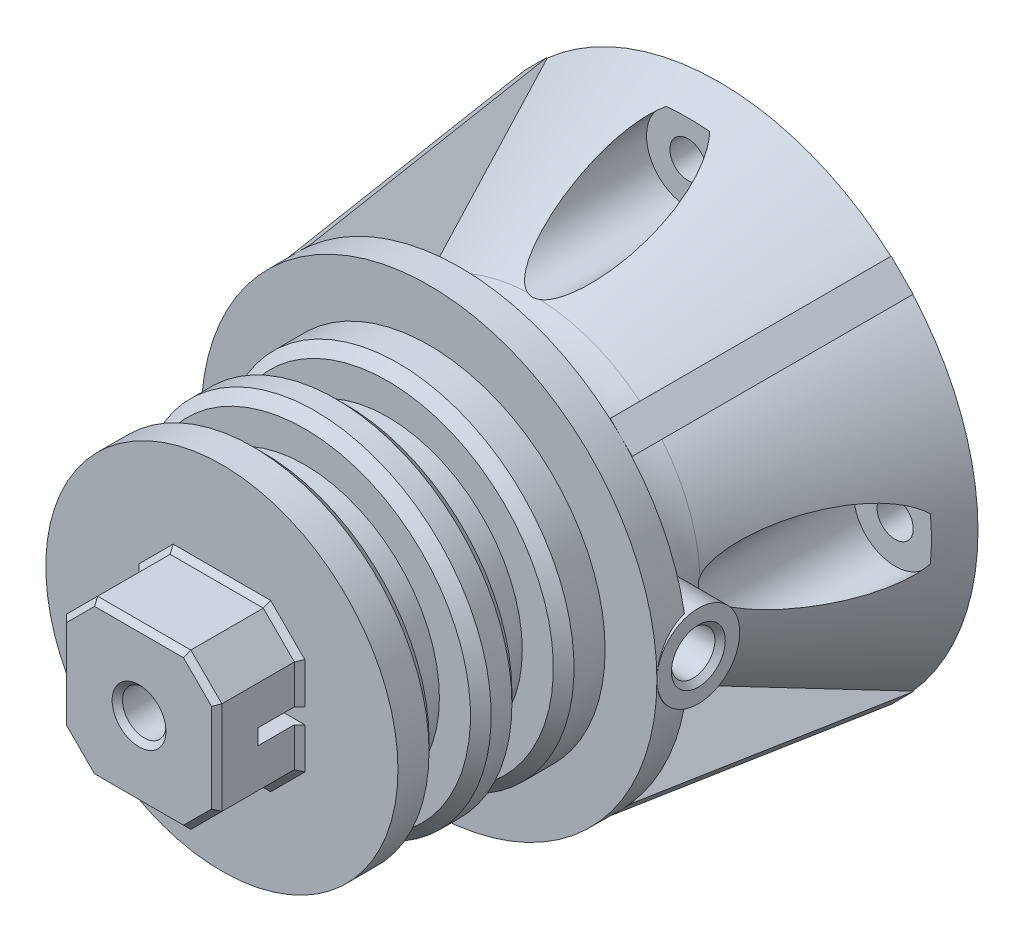
from build123d import *
from build123d.topology import SkipClean

# Parameters (mm, degrees)
SKETCH2_R           = 15
SKETCH1_R           = 25
SKETCH3_R           = 15
BOSS_EXTRUDE1_DEPTH = 5
FILLET1_R           = 10
SKETCH4_R           = 1.75
CUT_EXTRUDE1_DEPTH  = 130
SKETCH5_R           = 4
CUT_EXTRUDE2_DEPTH  = 130
SKETCH6_R           = 22
BOSS_EXTRUDE2_DEPTH = 3
SKETCH7_R           = 17
BOSS_EXTRUDE3_DEPTH = 20
SKETCH14_R          = 4
BOSS_EXTRUDE5_DEPTH = 10
SKETCH9_R           = 2.1
SKETCH10_R          = 10
CUT_EXTRUDE3_DEPTH  = 20
BOSS_EXTRUDE4_DEPTH = 1.5
CIRPATTERN2_COUNT   = 4
SKETCH15_W          = 8.431609766
SKETCH15_H          = 4
SKETCH15_W_2        = 8.578672696
SKETCH16_R          = 6.5
SKETCH16_R_2        = 2.5
BOSS_EXTRUDE6_DEPTH = 10
CHAMFER1_SIZE       = 1
CUT_EXTRUDE4_START  = -2
SKETCH17_R          = 4
CUT_EXTRUDE4_DEPTH  = 2
CHAMFER2_SIZE       = 0.5
SKETCH18_R          = 12.5
CUT_EXTRUDE5_DEPTH  = 20
BOSS_EXTRUDE7_START = 20
SKETCH19_R          = 10
BOSS_EXTRUDE7_DEPTH = 20
SKETCH20_W          = 15
SKETCH20_H          = 8
BOSS_EXTRUDE8_DEPTH = 7.5
CUT_EXTRUDE6_DEPTH  = 0.75
CUT_EXTRUDE7_START  = -28
SKETCH22_R          = 2.1
CUT_EXTRUDE7_DEPTH  = 28
CHAMFER3_SIZE       = 3
CHAMFER4_SIZE       = 0.5


with BuildPart() as part:
    # Sketch2 → Loft1 section 0
    with BuildSketch(Plane.XY.offset(20)):
        Circle(SKETCH2_R)
    # Sketch1 → Loft1 section 1
    with BuildSketch(Plane.XY):
        Circle(SKETCH1_R)
    loft()

    # Sketch3 → Boss-Extrude1 (add)
    with BuildSketch(Plane.XY.offset(20)):
        Circle(SKETCH3_R)
    extrude(amount=BOSS_EXTRUDE1_DEPTH)

    # Fillet1
    fillet1_edges = [part.edges().sort_by_distance(p)[0] for p in [
        (-15, 0, 20),
    ]]
    fillet(fillet1_edges, radius=FILLET1_R)

    # Sketch4 → Cut-Extrude1 (cut)
    with BuildSketch(Plane(origin=(0, 0, 0), x_dir=(-1, 0, 0), z_dir=(0, 0, -1))):
        with Locations((0, 20)):
            Circle(SKETCH4_R)
        with Locations((-20, 0)):
            Circle(SKETCH4_R)
        with Locations((0, -20)):
            Circle(SKETCH4_R)
        with Locations((20, 0)):
            Circle(SKETCH4_R)
    extrude(amount=-CUT_EXTRUDE1_DEPTH, mode=Mode.SUBTRACT)

    # Sketch5 → Cut-Extrude2 (cut)
    with BuildSketch(Plane(origin=(0, 0, 3), x_dir=(-1, 0, 0), z_dir=(0, 0, -1))):
        with Locations((0, 20)):
            Circle(SKETCH5_R)
        with Locations((20, 0)):
            Circle(SKETCH5_R)
        with Locations((-20, 0)):
            Circle(SKETCH5_R)
        with Locations((0, -20)):
            Circle(SKETCH5_R)
    extrude(amount=-CUT_EXTRUDE2_DEPTH, mode=Mode.SUBTRACT)

    # Sketch6 → Boss-Extrude2 (add)
    with BuildSketch(Plane.XY.offset(25)):
        Circle(SKETCH6_R)
    extrude(amount=BOSS_EXTRUDE2_DEPTH)

    # Sketch7 → Boss-Extrude3 (add)
    with BuildSketch(Plane.XY.offset(28)):
        Circle(SKETCH7_R)
    extrude(amount=BOSS_EXTRUDE3_DEPTH)

    # Sketch14 → Boss-Extrude5 (add)
    with BuildSketch(Plane(origin=(14, 0, 0), x_dir=(0, 0, -1), z_dir=(1, 0, 0))):
        with Locations(Location((-24, 0, 0), (0, 0, 180.000000004))):
            Circle(SKETCH14_R)
    extrude(amount=BOSS_EXTRUDE5_DEPTH)

    # Cut-Sweep1: sweep along a path in Sketch8
    with BuildLine(Plane(origin=(0, 0, 0), x_dir=(1, 0, 0), z_dir=(0, 1, 0))) as cut_sweep1_path:
        Line((0, -48), (0, -27))
        ThreePointArc((0, -27), (0.878679656, -24.878679656), (3, -24))
        Line((3, -24), (45.481948524, -24))
    # Sketch9 → Cut-Sweep1 (sweep, cut)
    with BuildSketch(Plane.XY.offset(48)):
        Circle(SKETCH9_R)
    sweep(path=cut_sweep1_path.line, mode=Mode.SUBTRACT)

    # Sketch10 → Cut-Extrude3 (cut)
    with BuildSketch(Plane.XY.offset(48)):
        Circle(SKETCH10_R)
    extrude(amount=-CUT_EXTRUDE3_DEPTH, mode=Mode.SUBTRACT)

    # Sketch12 → Boss-Extrude4 (add, symmetric)
    with BuildSketch(Plane(origin=(0, 0, 0), x_dir=(-0.7071067811865437, -0.7071067811865515, 0), z_dir=(-0.7071067811865515, 0.7071067811865437, 0))):
        with BuildLine():
            Line((22, 25), (25, 0))
            Line((25, 0), (23.881966011, 0))
            Line((23.881966011, 0), (15.161300899, 17.441330224))
            ThreePointArc((15.161300899, 17.441330224), (14.294261116, 19.833397649), (14, 22.360679775))
            Line((14, 22.360679775), (14, 25))
            Line((14, 25), (22, 25))
        make_face()
    boss_extrude4 = extrude(amount=BOSS_EXTRUDE4_DEPTH, both=True)

    # CirPattern2: Boss-Extrude4 ×4 about axis
    cirpattern2_axis = Axis((0, 0, 0), (0, 0, 1))
    for i in range(1, CIRPATTERN2_COUNT):
        add(boss_extrude4.rotate(cirpattern2_axis, i * 360 / CIRPATTERN2_COUNT))

    # Sketch15 → Cut-Revolve1 (revolve, cut)
    with BuildSketch(Plane(origin=(0, 0, 0), x_dir=(1, 0, 0), z_dir=(0, 1, 0))):
        with Locations((-17.215804883, -34)):
            Rectangle(SKETCH15_W, SKETCH15_H)
        with Locations((-17.289336348, -42)):
            Rectangle(SKETCH15_W_2, SKETCH15_H)
    revolve(axis=Axis((0, 0, 28), (0, 0, 1)), mode=Mode.SUBTRACT)

    # Sketch16 → Boss-Extrude6 (add)
    with BuildSketch(Plane.XY.offset(28)):
        Circle(SKETCH16_R)
        Circle(SKETCH16_R_2, mode=Mode.SUBTRACT)
    extrude(amount=BOSS_EXTRUDE6_DEPTH)

    # Chamfer1
    chamfer1_edges = [part.edges().sort_by_distance(p)[0] for p in [
        (-17, 0, 36),
        (-17, 0, 32),
        (-17, 0, 44),
        (-17, 0, 40),
        (-2.5, 0, 38),
    ]]
    chamfer(chamfer1_edges, length=CHAMFER1_SIZE)

    # Sketch17 → Cut-Extrude4 (cut)
    with BuildSketch(Plane(origin=(24, 0, 0), x_dir=(0, 0, -1), z_dir=(1, 0, 0)).offset(CUT_EXTRUDE4_START)):
        with Locations((-24, 0)):
            Circle(SKETCH17_R)
    extrude(amount=CUT_EXTRUDE4_DEPTH, mode=Mode.SUBTRACT)

    # Chamfer2
    chamfer2_edges = [part.edges().sort_by_distance(p)[0] for p in [
        (22, 0, 21.9),
    ]]
    chamfer(chamfer2_edges, length=CHAMFER2_SIZE)

    # Sketch18 → Cut-Extrude5 (cut)
    with BuildSketch(Plane(origin=(0, 0, 0), x_dir=(-1, 0, 0), z_dir=(0, 0, -1))):
        Circle(SKETCH18_R)
    extrude(amount=-CUT_EXTRUDE5_DEPTH, mode=Mode.SUBTRACT)

    # Sketch19 → Boss-Extrude7 (add)
    with BuildSketch(Plane.XY.offset(28).offset(BOSS_EXTRUDE7_START)):
        Circle(SKETCH19_R)
    extrude(amount=-BOSS_EXTRUDE7_DEPTH)

    # Sketch20 → Boss-Extrude8 (add, symmetric)
    with BuildSketch(Plane(origin=(0, 0, 0), x_dir=(1, 0, 0), z_dir=(0, 1, 0))):
        with Locations((0, -52)):
            Rectangle(SKETCH20_W, SKETCH20_H)
    extrude(amount=BOSS_EXTRUDE8_DEPTH, both=True)

    # Sketch21 → Cut-Extrude6 (cut, symmetric)
    with BuildSketch(Plane(origin=(0, 0, 0), x_dir=(1, 0, 0), z_dir=(0, 1, 0))):
        with BuildLine():
            Line((-7.5, -48), (-7.5, -52.009618943))
            ThreePointArc((-7.5, -52.009618943), (0, -50), (7.5, -52.009618943))
            Line((7.5, -52.009618943), (7.5, -48))
            Line((7.5, -48), (-7.5, -48))
        make_face()
    extrude(amount=CUT_EXTRUDE6_DEPTH, both=True, mode=Mode.SUBTRACT)

    # Sketch22 → Cut-Extrude7 (cut)
    with SkipClean():  # the faces are left unmerged after this step: merging them gives an invalid solid
        with BuildSketch(Plane.XY.offset(56).offset(CUT_EXTRUDE7_START)):
            with Locations(Location((0, 0, 0), (0, 0, 180))):
                Circle(SKETCH22_R)
        extrude(amount=CUT_EXTRUDE7_DEPTH, mode=Mode.SUBTRACT)
    add(part.part.scale(1), mode=Mode.REPLACE)  # the faces are merged on a copy

    # Chamfer3
    chamfer3_edges = [part.edges().sort_by_distance(p)[0] for p in [
        (7.5, -7.5, 52),
        (-7.5, -7.5, 52),
        (7.5, 7.5, 52),
        (-7.5, 7.5, 52),
    ]]
    chamfer(chamfer3_edges, length=CHAMFER3_SIZE)

    # Chamfer4
    chamfer4_edges = [part.edges().sort_by_distance(p)[0] for p in [
        (-7.5, -2.625, 48),
        (7.5, -2.625, 48),
        (2.1, 0, 56),
        (0, 7.5, 48),
        (0, 7.5, 56),
        (7.5, 2.625, 48),
        (7.5, 0, 56),
        (0, -7.5, 56),
        (-7.5, 0, 56),
        (6, -6, 56),
        (-6, -6, 56),
        (-6, 6, 56),
        (6, 6, 56),
        (-7.5, 2.625, 48),
        (0, -7.5, 48),
        (6, 6, 48),
        (-6, 6, 48),
        (-6, -6, 48),
        (6, -6, 48),
    ]]
    chamfer(chamfer4_edges, length=CHAMFER4_SIZE)


solid = part.part
